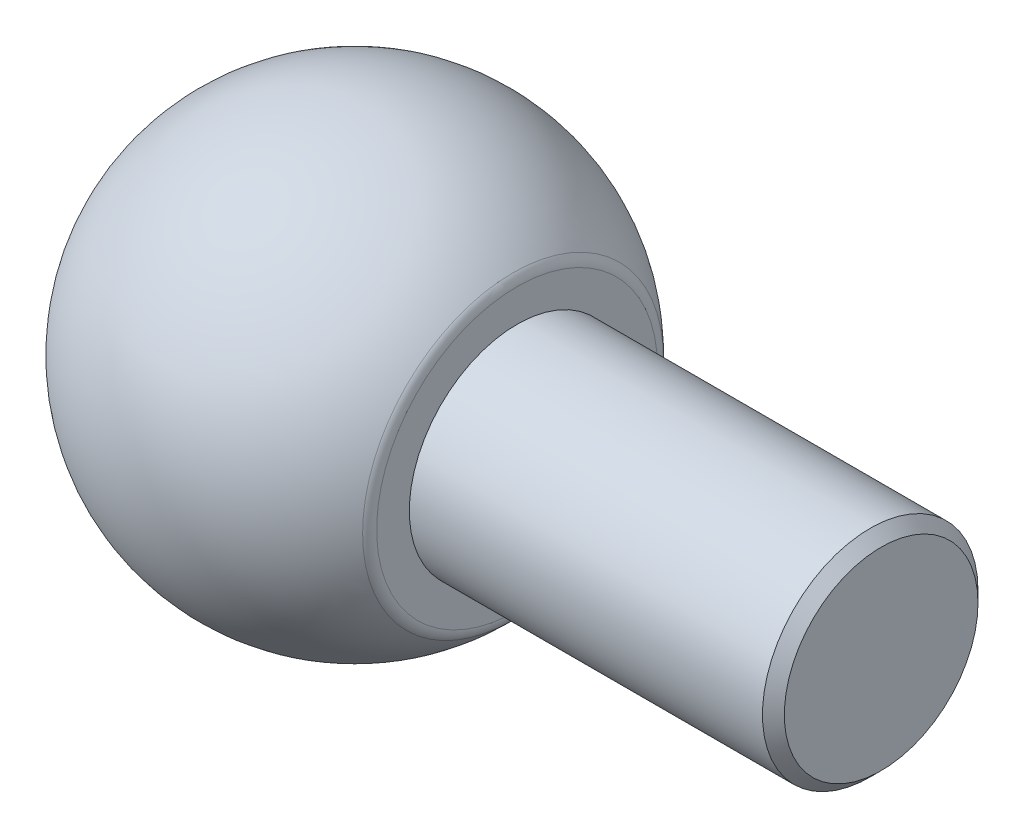
from build123d import *

# Parameters (mm, degrees)
SKETCH_2_R             = 2
CUT_EXTRUDE_1_DEPTH    = 7.77
SKETCH_3_R             = 1.48
EXTRUDE_1_DEPTH        = 5
FILLET_2_R             = 0.2
FILLET_3_R             = 0.2
CHAMFER_1_SIZE         = 0.15
SKETCH_4_R             = 1.6
CUT_EXTRUDE_3_DEPTH    = 2.465
HOLE_WIZARD_M3_2_D     = 2.5
HOLE_WIZARD_M3_2_DEPTH = 4
HOLE_WIZARD_M3_2_TIP   = 0.7510757737844503


# Some blends are built 0.0001 mm under size
with BuildPart() as part:
    # 草图1 → 旋转1 (revolve)
    with BuildSketch(Plane.XY):
        with BuildLine():
            Line((0, 2.999999999999999), (0, -2.999999999999999))
            ThreePointArc((0, -2.999999999999999), (2.999999999999999, 0), (0, 2.999999999999999))
        make_face()
    revolve(axis=Axis((0, 2.999999999999999, 0), (0, -1, 0)))

    # 草图2 → 切除-拉伸1 (cut)
    with BuildSketch(Plane(origin=(10, 0, 0), x_dir=(0, 0, -1), z_dir=(1, 0, 0))):
        Circle(SKETCH_2_R)
    extrude(amount=-CUT_EXTRUDE_1_DEPTH, mode=Mode.SUBTRACT)

    # 草图3 → 凸台-拉伸1 (add)
    with BuildSketch(Plane(origin=(2.2300000000000004, 0, 0), x_dir=(0, 0, -1), z_dir=(1, 0, 0))):
        Circle(SKETCH_3_R)
    extrude(amount=EXTRUDE_1_DEPTH)

    # 圆角2
    # the kernel refuses this fillet: 0.2 mm, written as the material it takes off along each edge
    with BuildSketch(Plane(origin=(2.236067977499788, 0, 0), x_dir=(0, 1, -1.8e-16), z_dir=(0, -1.8e-16, -1))) as fillet_2_piece_1:
        with BuildLine():
            CenterArc((1.8997145722011748, -0.17910795256821466), FILLET_2_R, 47.27584094143335, 12.629695301093555)
            Line((1.9999999999994043, -0.00606797750081567), (2, 0))
            ThreePointArc((2, 0), (2.0177683971304545, -0.0160205240561484), (2.0354084702155446, -0.03218223650167351))
        make_face()
    revolve(axis=Axis((2.236067977499788, 0, 0), (1, 0, 0)), revolution_arc=180, mode=Mode.SUBTRACT)
    with BuildSketch(Plane(origin=(2.236067977499788, 0, 0), x_dir=(0, -5.7e-16, -1), z_dir=(0, -1, 5.7e-16))) as fillet_2_piece_2:
        with BuildLine():
            CenterArc((1.8997145722011737, -0.17910795256821377), FILLET_2_R, 47.2758409414334, 12.629695301093115)
            Line((1.9999999999994045, -0.00606797750081522), (2, 0))
            ThreePointArc((2, 0), (2.0177683971304545, -0.01602052405614884), (2.0354084702155433, -0.03218223650167262))
        make_face()
    revolve(axis=Axis((2.236067977499788, 0, 0), (1, 0, 0)), revolution_arc=90.00000000000003, mode=Mode.SUBTRACT)
    with BuildSketch(Plane(origin=(2.236067977499788, 0, 0), x_dir=(0, -1, 6e-17), z_dir=(0, 6e-17, 1))) as fillet_2_piece_3:
        with BuildLine():
            CenterArc((1.8997145722011748, -0.17910795256821466), FILLET_2_R, 47.27584094143335, 12.629695301093555)
            Line((1.9999999999994043, -0.00606797750081567), (2, 0))
            ThreePointArc((2, 0), (2.0177683971304545, -0.0160205240561484), (2.0354084702155446, -0.03218223650167351))
        make_face()
    revolve(axis=Axis((2.236067977499788, 0, 0), (1, 0, 0)), revolution_arc=89.99999999999997, mode=Mode.SUBTRACT)

    # 圆角3
    fillet_3_edges = [part.edges().sort_by_distance(p)[0] for p in [
        (2.2299999999999995, -8.1e-16, 1.9999999999999996),
    ]]
    fillet(fillet_3_edges, radius=FILLET_3_R - 0.0001)  # a hair under: the kernel refuses the full size

    # 倒角1
    chamfer_1_edges = [part.edges().sort_by_distance(p)[0] for p in [
        (7.23, -4.8e-16, 1.48),
    ]]
    chamfer(chamfer_1_edges, length=CHAMFER_1_SIZE)

    # 草图4 → 切除-拉伸3 (cut)
    with BuildSketch(Plane(origin=(0, -5, 0), x_dir=(-1, 0, 0), z_dir=(0, 1, 0))):
        with Locations(Location((0, 0, 0), (0, 0, 90))):
            Circle(SKETCH_4_R)
    extrude(amount=CUT_EXTRUDE_3_DEPTH, mode=Mode.SUBTRACT)

    # M3 螺纹孔2
    with Locations(Plane(origin=(0, -2.535, 0), x_dir=(0, 0, -1), z_dir=(0, -1, 0))):
        with Locations((0, 0)):
            Hole(HOLE_WIZARD_M3_2_D / 2, depth=HOLE_WIZARD_M3_2_DEPTH)
            with Locations((0, 0, -(HOLE_WIZARD_M3_2_DEPTH + HOLE_WIZARD_M3_2_TIP / 2))):  # 118° drill point
                Cone(0, HOLE_WIZARD_M3_2_D / 2, HOLE_WIZARD_M3_2_TIP, mode=Mode.SUBTRACT)


solid = part.part
